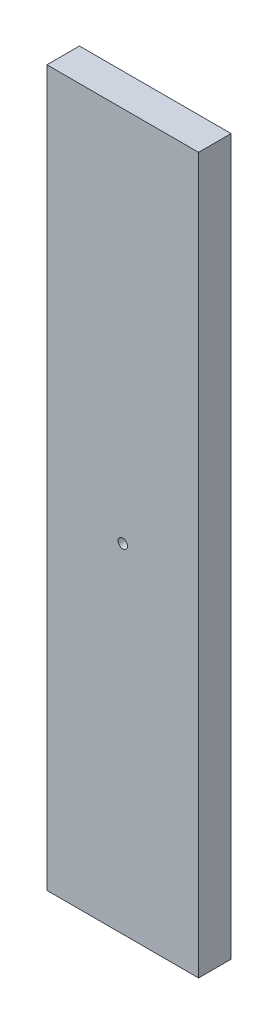
from build123d import *

# Parameters (mm, degrees)
SKETCH1_W           = 88.9
SKETCH1_H           = 19.05
BOSS_EXTRUDE1_DEPTH = 419.1
SKETCH2_R           = 2.778125
CUT_EXTRUDE1_DEPTH  = 429.848367725


with BuildPart() as part:
    # Sketch1 → Boss-Extrude1 (new body)
    with BuildSketch(Plane(origin=(0, 0, 0), x_dir=(1, 0, 0), z_dir=(0, 1, 0))):
        with Locations((44.45, 9.525)):
            Rectangle(SKETCH1_W, SKETCH1_H)
    extrude(amount=BOSS_EXTRUDE1_DEPTH)

    # Sketch2 → Cut-Extrude1 (cut, through all)
    with BuildSketch(Plane.XY):
        with Locations((44.45, 198.320839378)):
            Circle(SKETCH2_R)
    extrude(amount=-CUT_EXTRUDE1_DEPTH, mode=Mode.SUBTRACT)


solid = part.part
